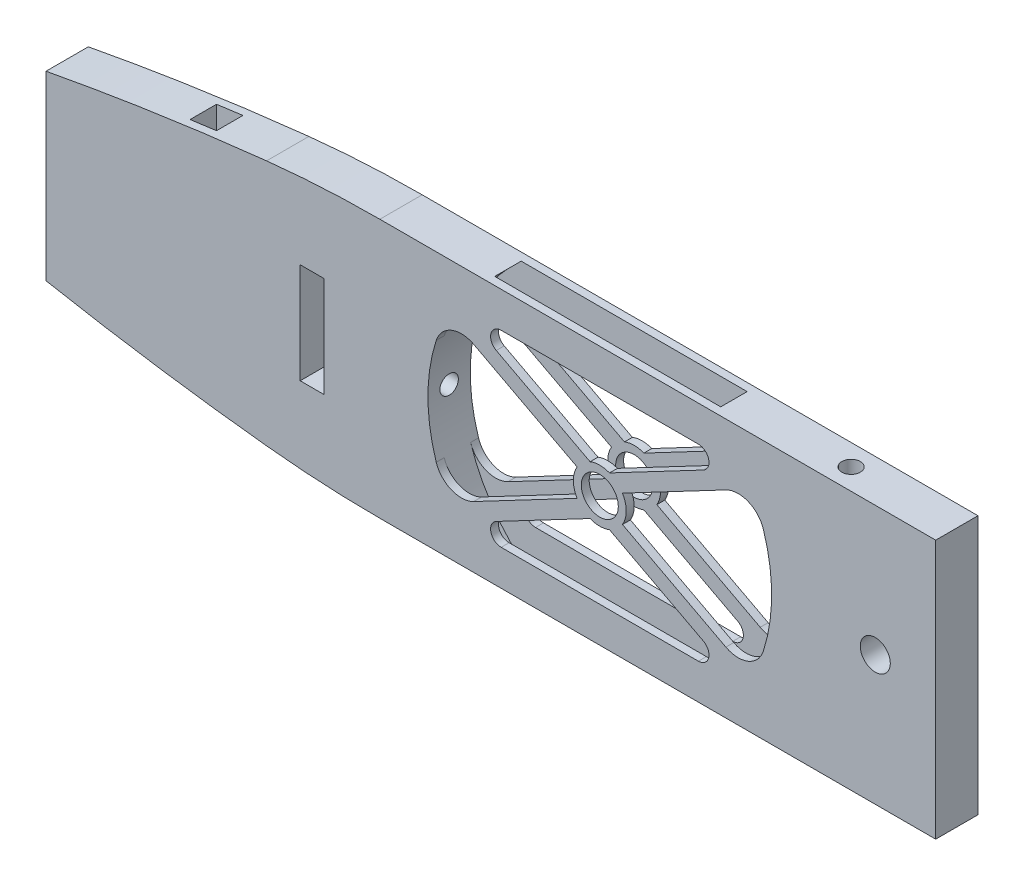
from build123d import *
from build123d.topology import SkipClean

# Parameters (mm, degrees)
BOSS_EXTRUDE1_DEPTH     = 8
FILLET2_R               = 2
SKETCH3_R               = 2.839661977
CUT_EXTRUDE1_DEPTH      = 8
SKETCH4_R               = 3.5
CUT_EXTRUDE2_DEPTH      = 8
CUT_EXTRUDE3_DEPTH      = 2.5
CUT_EXTRUDE3_DEPTH_BACK = 2.5
SKETCH5_R               = 32.5
SKETCH6_W               = 4.5
SKETCH6_H               = 19
CUT_EXTRUDE4_DEPTH      = 10
SKETCH7_R               = 1.75
CUT_EXTRUDE5_DEPTH      = 51
FILLET3_START           = -1
FILLET3_DEPTH           = 10
FILLET4_START           = -1
FILLET4_DEPTH           = 10
SKETCH9_W               = 5
SKETCH9_H               = 5
CUT_EXTRUDE6_DEPTH      = 51
SKETCH10_R              = 1.75
CUT_EXTRUDE7_DEPTH      = 24
FILLET5_DEPTH           = 1.5
FILLET5_START           = 6.5
FILLET5_2_DEPTH         = 1.5


with BuildPart() as part:
    # Sketch2 → Boss-Extrude1 (new body)
    with BuildSketch(Plane.XY):
        with BuildLine():
            Line((-102.95960155, 17.159933592), (-102.95960155, -17.159933592))
            add(Edge.make_bspline(
                [(-102.95960155, -17.159933592), (-76.189992309, -22.210205625), (-49.286425804, -24.488951052)],
                knots=[0, 0, 0, 0.320704871, 0.320704871, 0.320704871], degree=2))
            Line((-49.286425804, -24.488951052), (65.285160882, -24.488951052))
            Line((65.285160882, -24.488951052), (65.285160882, 24.488951052))
            Line((65.285160882, 24.488951052), (-49.286425804, 24.488951052))
            add(Edge.make_bspline(
                [(-102.95960155, 17.159933592), (-76.189992309, 22.210205625), (-49.286425804, 24.488951052)],
                knots=[0, 0, 0, 0.320704871, 0.320704871, 0.320704871], degree=2))
        make_face()
        with BuildLine():
            Line((-24.971677166, 17.771677006), (28.500163837, 17.771677006))
            Line((28.500163837, 17.771677006), (3.599814154, 4.650879462))
            ThreePointArc((3.599814154, 4.650879462), (1.764243335, 5), (-0.071327484, 4.650879462))
            Line((-0.071327484, 4.650879462), (-24.971677166, 17.771677006))
        make_face(mode=Mode.SUBTRACT)
        with BuildLine():
            Line((3.599814154, -4.650879462), (28.500163837, -17.771677006))
            Line((28.500163837, -17.771677006), (-24.971677166, -17.771677006))
            Line((-24.971677166, -17.771677006), (-0.071327484, -4.650879462))
            ThreePointArc((-0.071327484, -4.650879462), (1.764243335, -5), (3.599814154, -4.650879462))
        make_face(mode=Mode.SUBTRACT)
        with BuildLine():
            Line((-2.525196045, 2.569184657), (-26.859859934, 15.391904107))
            ThreePointArc((-26.859859934, 15.391904107), (-30.735756665, 0), (-26.859859934, -15.391904107))
            Line((-26.859859934, -15.391904107), (-2.525196045, -2.569184657))
            ThreePointArc((-2.525196045, -2.569184657), (-3.235756665, 0), (-2.525196045, 2.569184657))
        make_face(mode=Mode.SUBTRACT)
        with BuildLine():
            Line((6.053682716, -2.569184657), (30.388346604, -15.391904107))
            ThreePointArc((30.388346604, -15.391904107), (34.264243335, 0), (30.388346604, 15.391904107))
            Line((30.388346604, 15.391904107), (6.053682716, 2.569184657))
            ThreePointArc((6.053682716, 2.569184657), (6.764243335, 0), (6.053682716, -2.569184657))
        make_face(mode=Mode.SUBTRACT)
    extrude(amount=BOSS_EXTRUDE1_DEPTH)

    # Fillet2
    fillet2_edges = [part.edges().sort_by_distance(p)[0] for p in [
        (-24.971677166, 17.771677006, 4),
        (28.500163837, 17.771677006, 4),
        (-24.971677166, -17.771677006, 4),
        (28.500163837, -17.771677006, 4),
    ]]
    fillet(fillet2_edges, radius=FILLET2_R)

    # Sketch3 → Cut-Extrude1 (cut)
    with BuildSketch(Plane.XY.offset(8)):
        with Locations((53.859940094, 0)):
            Circle(SKETCH3_R)
    extrude(amount=-CUT_EXTRUDE1_DEPTH, mode=Mode.SUBTRACT)

    # Sketch4 → Cut-Extrude2 (cut)
    with BuildSketch(Plane.XY.offset(8)):
        with Locations((1.764243335, 0)):
            Circle(SKETCH4_R)
    extrude(amount=-CUT_EXTRUDE2_DEPTH, mode=Mode.SUBTRACT)

    # Sketch5 → Cut-Extrude3 (cut, two sides: drawn at the far end of the back side and taken through both)
    with SkipClean():  # the faces are left unmerged after this step: merging them gives an invalid solid
        with BuildSketch(Plane.XY.offset(4).offset(-CUT_EXTRUDE3_DEPTH_BACK)):
            with Locations((1.764243335, 0)):
                Circle(SKETCH5_R)
        extrude(amount=CUT_EXTRUDE3_DEPTH + CUT_EXTRUDE3_DEPTH_BACK, mode=Mode.SUBTRACT)

    # Sketch6 → Cut-Extrude4 (cut)
    with SkipClean():  # the faces are left unmerged after this step: merging them gives an invalid solid
        with BuildSketch(Plane.XY.offset(8)):
            with Locations((-52.644112073, 0)):
                Rectangle(SKETCH6_W, SKETCH6_H)
        extrude(amount=-CUT_EXTRUDE4_DEPTH, mode=Mode.SUBTRACT)

    # Sketch7 → Cut-Extrude5 (cut)
    with SkipClean():  # the faces are left unmerged after this step: merging them gives an invalid solid
        with BuildSketch(Plane(origin=(0, 24.488951052, 0), x_dir=(1, 0, 0), z_dir=(0, 1, 0))):
            with Locations(Location((45.285160882, -4, 0), (0, 0, 270))):
                Circle(SKETCH7_R)
        extrude(amount=-CUT_EXTRUDE5_DEPTH, mode=Mode.SUBTRACT)

    # Fillet3: read off the stored shape, not the designer's step
    # Fillet3 outline → Fillet3 (cut)
    with SkipClean():  # the faces are left unmerged after this step: merging them gives an invalid solid
        with BuildSketch(Plane.XY.offset(FILLET3_START)):
            with BuildLine():
                add(Edge.make_bspline(
                    [(-49.286425804, 24.488951052), (-55.269151656, 23.982211205), (-61.245253134, 23.338415518)],
                    knots=[0, 0, 0, 0.071317285, 0.071317285, 0.071317285], degree=2))
                ThreePointArc((-61.245253134, 23.338415518), (-50.549825889, 24.201110037), (-39.823523948, 24.488951052))
                Line((-39.823523948, 24.488951052), (-49.286425804, 24.488951052))
            make_face()
        extrude(amount=FILLET3_DEPTH, mode=Mode.SUBTRACT)

    # Fillet4: read off the stored shape, not the designer's step
    # Fillet4 outline → Fillet4 (cut)
    with SkipClean():  # the faces are left unmerged after this step: merging them gives an invalid solid
        with BuildSketch(Plane.XY.offset(FILLET4_START)):
            with BuildLine():
                Line((-49.286425804, -24.488951052), (-39.823523948, -24.488951052))
                ThreePointArc((-39.823523948, -24.488951052), (-50.549825889, -24.201110037), (-61.245253134, -23.338415518))
                add(Edge.make_bspline(
                    [(-61.245253134, -23.338415518), (-55.269151656, -23.982211205), (-49.286425804, -24.488951052)],
                    knots=[0.249387586, 0.249387586, 0.249387586, 0.320704871, 0.320704871, 0.320704871], degree=2))
            make_face()
        extrude(amount=FILLET4_DEPTH, mode=Mode.SUBTRACT)

    # Sketch9 → Cut-Extrude6 (cut)
    with SkipClean():  # the faces are left unmerged after this step: merging them gives an invalid solid
        with BuildSketch(Plane(origin=(0, 24.488951052, 0), x_dir=(1, 0, 0), z_dir=(0, 1, 0))):
            with Locations((-74.714839118, -4)):
                Rectangle(SKETCH9_W, SKETCH9_H)
        extrude(amount=-CUT_EXTRUDE6_DEPTH, mode=Mode.SUBTRACT)

    # Sketch10 → Cut-Extrude7 (cut)
    with SkipClean():  # the faces are left unmerged after this step: merging them gives an invalid solid
        with BuildSketch(Plane.ZY.offset(50.394112073)):
            with Locations((4, 0)):
                Circle(SKETCH10_R)
        extrude(amount=-CUT_EXTRUDE7_DEPTH, mode=Mode.SUBTRACT)

    # Fillet5: read off the stored shape, not the designer's step
    # Fillet5 outline → Fillet5 (add)
    with SkipClean():  # the faces are left unmerged after this step: merging them gives an invalid solid
        with BuildSketch(Plane.XY):
            with BuildLine():
                Line((30.388346604, 15.391904107), (25.603831674, 12.87078884))
                ThreePointArc((25.603831674, 12.87078884), (29.820861326, 13.077915151), (32.692963641, 9.983198898))
                ThreePointArc((32.692963641, 9.983198898), (31.663210239, 12.739771507), (30.388346604, 15.391904107))
            make_face()
            with BuildLine():
                ThreePointArc((30.388346604, -15.391904107), (31.663210239, -12.739771507), (32.692963641, -9.983198898))
                ThreePointArc((32.692963641, -9.983198898), (29.820861326, -13.077915151), (25.603831674, -12.87078884))
                Line((25.603831674, -12.87078884), (30.388346604, -15.391904107))
            make_face()
            with BuildLine():
                Line((-26.859859934, -15.391904107), (-22.075345003, -12.87078884))
                ThreePointArc((-22.075345003, -12.87078884), (-26.292374655, -13.077915151), (-29.164476971, -9.983198898))
                ThreePointArc((-29.164476971, -9.983198898), (-28.134723569, -12.739771507), (-26.859859934, -15.391904107))
            make_face()
            with BuildLine():
                ThreePointArc((-26.859859934, 15.391904107), (-28.134723569, 12.739771507), (-29.164476971, 9.983198898))
                ThreePointArc((-29.164476971, 9.983198898), (-26.292374655, 13.077915151), (-22.075345003, 12.87078884))
                Line((-22.075345003, 12.87078884), (-26.859859934, 15.391904107))
            make_face()
        extrude(amount=FILLET5_DEPTH)

    # Fillet5 2 outline → Fillet5 2 (add)
    with SkipClean():  # the faces are left unmerged after this step: merging them gives an invalid solid
        with BuildSketch(Plane.XY.offset(FILLET5_START)):
            with BuildLine():
                Line((30.388346604, 15.391904107), (25.603831674, 12.87078884))
                ThreePointArc((25.603831674, 12.87078884), (29.820861326, 13.077915151), (32.692963641, 9.983198898))
                ThreePointArc((32.692963641, 9.983198898), (31.663210239, 12.739771507), (30.388346604, 15.391904107))
            make_face()
            with BuildLine():
                ThreePointArc((30.388346604, -15.391904107), (31.663210239, -12.739771507), (32.692963641, -9.983198898))
                ThreePointArc((32.692963641, -9.983198898), (29.820861326, -13.077915151), (25.603831674, -12.87078884))
                Line((25.603831674, -12.87078884), (30.388346604, -15.391904107))
            make_face()
            with BuildLine():
                Line((-26.859859934, -15.391904107), (-22.075345003, -12.87078884))
                ThreePointArc((-22.075345003, -12.87078884), (-26.292374655, -13.077915151), (-29.164476971, -9.983198898))
                ThreePointArc((-29.164476971, -9.983198898), (-28.134723569, -12.739771507), (-26.859859934, -15.391904107))
            make_face()
            with BuildLine():
                ThreePointArc((-26.859859934, 15.391904107), (-28.134723569, 12.739771507), (-29.164476971, 9.983198898))
                ThreePointArc((-29.164476971, 9.983198898), (-26.292374655, 13.077915151), (-22.075345003, 12.87078884))
                Line((-22.075345003, 12.87078884), (-26.859859934, 15.391904107))
            make_face()
        extrude(amount=FILLET5_2_DEPTH)


solid = part.part
